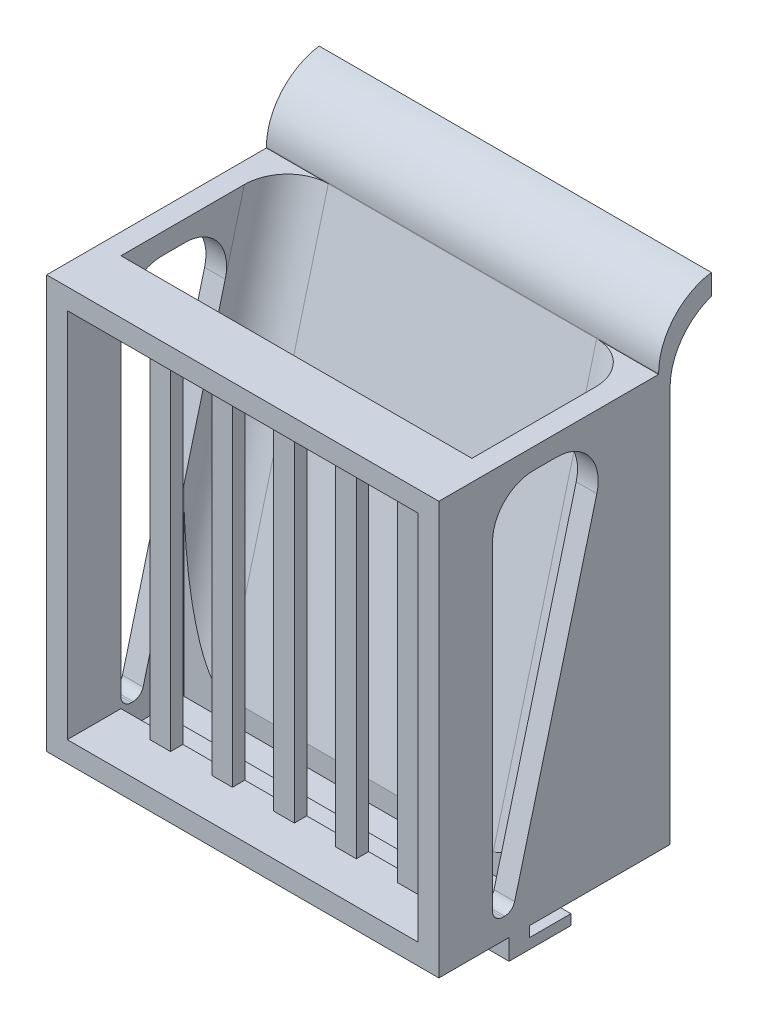
from build123d import *

# Parameters (mm, degrees)
SKETCH1_W                = 5
SKETCH1_H                = 90
SKETCH1_H_2              = 5
SKETCH1_W_2              = 10
BOSS_EXTRUDE1_DEPTH      = 3
SKETCH1_3_W              = 5
SKETCH1_3_H              = 5
SKETCH1_3_H_2            = 90
SKETCH1_3_W_2            = 10
BOSS_EXTRUDE2_DEPTH      = 13
SKETCH2_W                = 5
SKETCH2_H                = 5
BOSS_EXTRUDE3_DEPTH      = 33
BOSS_EXTRUDE4_DEPTH      = 10
BOSS_EXTRUDE4_DEPTH_BACK = 17.787183465
SKETCH3_W                = 95
SKETCH3_H                = 100
SKETCH7_W                = 85
SKETCH7_H                = 5
SKETCH7_W_2              = 5
BOSS_EXTRUDE6_DEPTH      = 5
SKETCH8_W                = 95
SKETCH8_H                = 2.5
BOSS_EXTRUDE7_DEPTH      = 10
CUT_EXTRUDE1_DEPTH       = 132.816960102
BOSS_EXTRUDE9_REACH      = 101.483
SKETCH9_W                = 5
SKETCH9_H                = 5
SKETCH11_W               = 5
SKETCH11_H               = 93.06639607
BOSS_EXTRUDE12_DEPTH     = 10
SKETCH13_W               = 5
SKETCH13_H               = 10
BOSS_EXTRUDE13_DEPTH     = 4
FILLET2_R                = 10
FILLET3_START            = -44.017467249
FILLET3_DEPTH            = 5
FILLET3_START_2          = 45.982532751
FILLET3_2_DEPTH          = 5
FILLET4_R                = 10
SKETCH14_W               = 95
SKETCH14_H               = 2.777998613
BOSS_EXTRUDE14_DEPTH     = 15
SKETCH15_W               = 95
SKETCH15_H               = 5
BOSS_EXTRUDE15_DEPTH     = 10
FILLET5_R                = 15


with BuildPart() as part:
    # Sketch1 → Boss-Extrude1 (new body)
    with BuildSketch(Plane.XY):
        with Locations((48.482532751, -25.633187773)):
            Rectangle(SKETCH1_W, SKETCH1_H)
        with Locations((48.482532751, 21.866812227)):
            Rectangle(SKETCH1_W, SKETCH1_H_2)
        with Locations((40.982532751, 21.866812227)):
            Rectangle(SKETCH1_W_2, SKETCH1_H_2)
        with Locations((33.482532751, 21.866812227)):
            Rectangle(SKETCH1_W, SKETCH1_H_2)
        with Locations((33.482532751, -25.633187773)):
            Rectangle(SKETCH1_W, SKETCH1_H)
        with Locations((18.482532751, -25.633187773)):
            Rectangle(SKETCH1_W, SKETCH1_H)
        with Locations((18.482532751, 21.866812227)):
            Rectangle(SKETCH1_W, SKETCH1_H_2)
        with Locations((25.982532751, 21.866812227)):
            Rectangle(SKETCH1_W_2, SKETCH1_H_2)
        with Locations((10.982532751, 21.866812227)):
            Rectangle(SKETCH1_W_2, SKETCH1_H_2)
        with Locations((3.482532751, 21.866812227)):
            Rectangle(SKETCH1_W, SKETCH1_H_2)
        with Locations((3.482532751, -25.633187773)):
            Rectangle(SKETCH1_W, SKETCH1_H)
        with Locations((-4.017467249, 21.866812227)):
            Rectangle(SKETCH1_W_2, SKETCH1_H_2)
        with Locations((-11.517467249, 21.866812227)):
            Rectangle(SKETCH1_W, SKETCH1_H_2)
        with Locations((-11.517467249, -25.633187773)):
            Rectangle(SKETCH1_W, SKETCH1_H)
        with Locations((-19.017467249, 21.866812227)):
            Rectangle(SKETCH1_W_2, SKETCH1_H_2)
        with Locations((-26.517467249, 21.866812227)):
            Rectangle(SKETCH1_W, SKETCH1_H_2)
        with Locations((-26.517467249, -25.633187773)):
            Rectangle(SKETCH1_W, SKETCH1_H)
        with Locations((-34.017467249, 21.866812227)):
            Rectangle(SKETCH1_W_2, SKETCH1_H_2)
        with Locations((-41.517467249, 21.866812227)):
            Rectangle(SKETCH1_W, SKETCH1_H_2)
        with Locations((-41.517467249, -25.633187773)):
            Rectangle(SKETCH1_W, SKETCH1_H)
        with Locations((48.482532751, -73.133187773)):
            Rectangle(SKETCH1_W, SKETCH1_H_2)
        with Locations((40.982532751, -73.133187773)):
            Rectangle(SKETCH1_W_2, SKETCH1_H_2)
        with Locations((33.482532751, -73.133187773)):
            Rectangle(SKETCH1_W, SKETCH1_H_2)
        with Locations((25.982532751, -73.133187773)):
            Rectangle(SKETCH1_W_2, SKETCH1_H_2)
        with Locations((18.482532751, -73.133187773)):
            Rectangle(SKETCH1_W, SKETCH1_H_2)
        with Locations((10.982532751, -73.133187773)):
            Rectangle(SKETCH1_W_2, SKETCH1_H_2)
        with Locations((3.482532751, -73.133187773)):
            Rectangle(SKETCH1_W, SKETCH1_H_2)
        with Locations((-4.017467249, -73.133187773)):
            Rectangle(SKETCH1_W_2, SKETCH1_H_2)
        with Locations((-11.517467249, -73.133187773)):
            Rectangle(SKETCH1_W, SKETCH1_H_2)
        with Locations((-19.017467249, -73.133187773)):
            Rectangle(SKETCH1_W_2, SKETCH1_H_2)
        with Locations((-26.517467249, -73.133187773)):
            Rectangle(SKETCH1_W, SKETCH1_H_2)
        with Locations((-34.017467249, -73.133187773)):
            Rectangle(SKETCH1_W_2, SKETCH1_H_2)
        with Locations((-41.517467249, -73.133187773)):
            Rectangle(SKETCH1_W, SKETCH1_H_2)
    extrude(amount=BOSS_EXTRUDE1_DEPTH)

    # Sketch1<3> → Boss-Extrude2 (add)
    with BuildSketch(Plane.XY):
        with Locations((48.482532751, 21.866812227)):
            Rectangle(SKETCH1_3_W, SKETCH1_3_H)
        with Locations((48.482532751, -25.633187773)):
            Rectangle(SKETCH1_3_W, SKETCH1_3_H_2)
        with Locations((48.482532751, -73.133187773)):
            Rectangle(SKETCH1_3_W, SKETCH1_3_H)
        with Locations((40.982532751, 21.866812227)):
            Rectangle(SKETCH1_3_W_2, SKETCH1_3_H)
        with Locations((33.482532751, 21.866812227)):
            Rectangle(SKETCH1_3_W, SKETCH1_3_H)
        with Locations((25.982532751, 21.866812227)):
            Rectangle(SKETCH1_3_W_2, SKETCH1_3_H)
        with Locations((18.482532751, 21.866812227)):
            Rectangle(SKETCH1_3_W, SKETCH1_3_H)
        with Locations((10.982532751, 21.866812227)):
            Rectangle(SKETCH1_3_W_2, SKETCH1_3_H)
        with Locations((3.482532751, 21.866812227)):
            Rectangle(SKETCH1_3_W, SKETCH1_3_H)
        with Locations((-4.017467249, 21.866812227)):
            Rectangle(SKETCH1_3_W_2, SKETCH1_3_H)
        with Locations((-11.517467249, 21.866812227)):
            Rectangle(SKETCH1_3_W, SKETCH1_3_H)
        with Locations((-19.017467249, 21.866812227)):
            Rectangle(SKETCH1_3_W_2, SKETCH1_3_H)
        with Locations((-26.517467249, 21.866812227)):
            Rectangle(SKETCH1_3_W, SKETCH1_3_H)
        with Locations((-34.017467249, 21.866812227)):
            Rectangle(SKETCH1_3_W_2, SKETCH1_3_H)
        with Locations((-41.517467249, 21.866812227)):
            Rectangle(SKETCH1_3_W, SKETCH1_3_H)
        with Locations((-41.517467249, -25.633187773)):
            Rectangle(SKETCH1_3_W, SKETCH1_3_H_2)
        with Locations((-41.517467249, -73.133187773)):
            Rectangle(SKETCH1_3_W, SKETCH1_3_H)
        with Locations((40.982532751, -73.133187773)):
            Rectangle(SKETCH1_3_W_2, SKETCH1_3_H)
        with Locations((33.482532751, -73.133187773)):
            Rectangle(SKETCH1_3_W, SKETCH1_3_H)
        with Locations((25.982532751, -73.133187773)):
            Rectangle(SKETCH1_3_W_2, SKETCH1_3_H)
        with Locations((18.482532751, -73.133187773)):
            Rectangle(SKETCH1_3_W, SKETCH1_3_H)
        with Locations((10.982532751, -73.133187773)):
            Rectangle(SKETCH1_3_W_2, SKETCH1_3_H)
        with Locations((3.482532751, -73.133187773)):
            Rectangle(SKETCH1_3_W, SKETCH1_3_H)
        with Locations((-4.017467249, -73.133187773)):
            Rectangle(SKETCH1_3_W_2, SKETCH1_3_H)
        with Locations((-11.517467249, -73.133187773)):
            Rectangle(SKETCH1_3_W, SKETCH1_3_H)
        with Locations((-19.017467249, -73.133187773)):
            Rectangle(SKETCH1_3_W_2, SKETCH1_3_H)
        with Locations((-26.517467249, -73.133187773)):
            Rectangle(SKETCH1_3_W, SKETCH1_3_H)
        with Locations((-34.017467249, -73.133187773)):
            Rectangle(SKETCH1_3_W_2, SKETCH1_3_H)
    extrude(amount=BOSS_EXTRUDE2_DEPTH)

    # Sketch2 → Boss-Extrude3 (add)
    with BuildSketch(Plane(origin=(0, 0, 0), x_dir=(-1, 0, 0), z_dir=(0, 0, -1))):
        with Locations((-48.482532751, 21.866812227)):
            Rectangle(SKETCH2_W, SKETCH2_H)
        with Locations((41.517467249, 21.866812227)):
            Rectangle(SKETCH2_W, SKETCH2_H)
        with Locations((41.517467249, -73.133187773)):
            Rectangle(SKETCH2_W, SKETCH2_H)
        with Locations((-48.482532751, -73.133187773)):
            Rectangle(SKETCH2_W, SKETCH2_H)
    extrude(amount=BOSS_EXTRUDE3_DEPTH)

    # Sketch3 → Boss-Extrude4 (add, two sides: drawn at the far end of the back side and taken through both)
    with BuildSketch(Plane(origin=(0, 0, -33), x_dir=(-1, 0, 0), z_dir=(0, 0, -1)).offset(-BOSS_EXTRUDE4_DEPTH_BACK)):
        with Locations((-3.482532751, -25.633187773)):
            Rectangle(SKETCH3_W, SKETCH3_H)
    extrude(amount=BOSS_EXTRUDE4_DEPTH + BOSS_EXTRUDE4_DEPTH_BACK)

    # Sketch7 → Boss-Extrude6 (add)
    with BuildSketch(Plane.XZ.offset(75.633187773)):
        with Locations((3.482532751, -6.5)):
            Rectangle(SKETCH7_W, SKETCH7_H)
        with Locations((48.482532751, -6.5)):
            Rectangle(SKETCH7_W_2, SKETCH7_H)
        with Locations((-41.517467249, -6.5)):
            Rectangle(SKETCH7_W_2, SKETCH7_H)
    extrude(amount=BOSS_EXTRUDE6_DEPTH)

    # Sketch8 → Boss-Extrude7 (add)
    with BuildSketch(Plane(origin=(0, 0, -9), x_dir=(-1, 0, 0), z_dir=(0, 0, -1))):
        with Locations((-3.482532751, -79.383187773)):
            Rectangle(SKETCH8_W, SKETCH8_H)
    extrude(amount=BOSS_EXTRUDE7_DEPTH)

    # Sketch5 → Cut-Extrude1 (cut, through all)
    with BuildSketch(Plane.ZY.offset(44.017467249)):
        Polygon((-15.212816535, -70.633187773), (-40.222001387, 24.366812227), (-15.212816535, 24.366812227), align=None)
    extrude(amount=-CUT_EXTRUDE1_DEPTH, mode=Mode.SUBTRACT)

    # Sketch9 → Boss-Extrude9 (add, up to next)
    with BuildSketch(Plane(origin=(0, 0, -15.212816535), x_dir=(-1, 0, 0), z_dir=(0, 0, -1)), mode=Mode.PRIVATE) as boss_extrude9_sk1:
        with Locations((41.517467249, 21.866812227)):
            Rectangle(SKETCH9_W, SKETCH9_H)
    boss_extrude9_tool1 = extrude(boss_extrude9_sk1.sketch, amount=BOSS_EXTRUDE9_REACH, mode=Mode.PRIVATE) - part.part
    # Sketch9 → Boss-Extrude9 (add, up to next)
    with BuildSketch(Plane(origin=(0, 0, -15.212816535), x_dir=(-1, 0, 0), z_dir=(0, 0, -1)), mode=Mode.PRIVATE) as boss_extrude9_sk2:
        with Locations((-48.482532751, 21.866812227)):
            Rectangle(SKETCH9_W, SKETCH9_H)
    boss_extrude9_tool2 = extrude(boss_extrude9_sk2.sketch, amount=BOSS_EXTRUDE9_REACH, mode=Mode.PRIVATE) - part.part
    add(boss_extrude9_tool1.solids().sort_by_distance((-41.517467, 21.866812, -15.212817))[0])
    add(boss_extrude9_tool2.solids().sort_by_distance((48.482533, 21.866812, -15.212817))[0])

    # Sketch11 → Boss-Extrude12 (add)
    with BuildSketch(Plane(origin=(0, -8.323116729, -31.616227955), x_dir=(1, 0, 0), z_dir=(0, 0.2545807398296556, 0.9670515223646491))):
        with Locations((-41.517467249, -17.899843642)):
            Rectangle(SKETCH11_W, SKETCH11_H)
        with Locations((48.482532751, -17.899843642)):
            Rectangle(SKETCH11_W, SKETCH11_H)
    extrude(amount=BOSS_EXTRUDE12_DEPTH)

    # Sketch13 → Boss-Extrude13 (add)
    with BuildSketch(Plane(origin=(0, -62.310071044, 16.40341142), x_dir=(1, 0, 0), z_dir=(0, -0.9670515223646491, 0.2545807398296557))):
        with Locations((48.482532751, -27.69342659)):
            Rectangle(SKETCH13_W, SKETCH13_H)
        with Locations((-41.517467249, -27.69342659)):
            Rectangle(SKETCH13_W, SKETCH13_H)
    extrude(amount=BOSS_EXTRUDE13_DEPTH)

    # Fillet2
    # the kernel refuses this fillet: 10 mm, written as the material it adds along each edge
    with BuildSketch(Plane(origin=(45.982532751, 19.366812227, 0), x_dir=(0, 0, -1), z_dir=(1, 0, 0)), Plane(origin=(-39.017467249, 19.366812227, 0), x_dir=(0, -1, 0), z_dir=(-1, 0, 0))) as fillet2_piece_1:
        with BuildLine():
            CenterArc((FILLET2_R, -FILLET2_R), FILLET2_R, 90, 90)
            Line((0, -FILLET2_R), (0, 0))
            Line((0, 0), (FILLET2_R, 0))
        make_face()
    extrude(amount=5)
    with BuildSketch(Plane(origin=(-39.017467249, 19.366812227, -28.565017825), x_dir=(0, -0.9670515223646489, 0.25458073982965584), z_dir=(-1, 0, 0))) as fillet2_piece_2:
        with BuildLine():
            CenterArc((FILLET2_R * 1.29732564482, FILLET2_R), FILLET2_R, 165.251256556, 104.748743444)
            Line((FILLET2_R * 0.330274122459, FILLET2_R * 1.25458073983), (0, 0))
            Line((0, 0), (FILLET2_R * 1.29732564482, 0))
        make_face()
    extrude(amount=5)
    with BuildSketch(Plane(origin=(50.982532751, 19.366812227, -28.565017825), x_dir=(0, 0, 1), z_dir=(-1, 0, 0))) as fillet2_piece_3:
        with BuildLine():
            CenterArc((FILLET2_R * 1.29732564482, -FILLET2_R), FILLET2_R, 90, 104.748743444)
            Line((FILLET2_R * 0.330274122459, -FILLET2_R * 1.25458073983), (0, 0))
            Line((0, 0), (FILLET2_R * 1.29732564482, 0))
        make_face()
    extrude(amount=5)

    # Fillet3: read off the stored shape, not the designer's step
    # Fillet3 outline → Fillet3 (add)
    with BuildSketch(Plane.YZ.offset(FILLET3_START)):
        with BuildLine():
            Line((-70.633187773, -4.872105861), (-68.769639622, -5.362693442))
            ThreePointArc((-68.769639622, -5.362693442), (-70.113229391, -4.471313367), (-70.633187773, -2.945064636))
            Line((-70.633187773, -2.945064636), (-70.633187773, -4.872105861))
        make_face()
        with BuildLine():
            Line((-70.633187773, 0), (-70.633187773, -2.5))
            ThreePointArc((-70.633187773, -2.5), (-69.900954726, -0.732233047), (-68.133187773, 0))
            Line((-68.133187773, 0), (-70.633187773, 0))
        make_face()
    extrude(amount=FILLET3_DEPTH)

    # Fillet3 2 outline → Fillet3 2 (add)
    with BuildSketch(Plane.YZ.offset(FILLET3_START_2)):
        with BuildLine():
            Line((-70.633187773, -4.872105861), (-68.769639622, -5.362693442))
            ThreePointArc((-68.769639622, -5.362693442), (-70.113229391, -4.471313367), (-70.633187773, -2.945064636))
            Line((-70.633187773, -2.945064636), (-70.633187773, -4.872105861))
        make_face()
        with BuildLine():
            Line((-70.633187773, 0), (-70.633187773, -2.5))
            ThreePointArc((-70.633187773, -2.5), (-69.900954726, -0.732233047), (-68.133187773, 0))
            Line((-68.133187773, 0), (-70.633187773, 0))
        make_face()
    extrude(amount=FILLET3_2_DEPTH)

    # Fillet4
    fillet4_edges = [part.edges().sort_by_distance(p)[0] for p in [
        (-39.017467249, -23.133187773, -27.717408961),
        (45.982532751, -23.133187773, -27.717408961),
    ]]
    fillet(fillet4_edges, radius=FILLET4_R - 0.0001)  # a hair under: the kernel refuses the full size

    # Sketch14 → Boss-Extrude14 (add)
    with BuildSketch(Plane(origin=(0, 24.366812227, 0), x_dir=(1, 0, 0), z_dir=(0, 1, 0))):
        with Locations((3.482532751, 41.611000694)):
            Rectangle(SKETCH14_W, SKETCH14_H)
    extrude(amount=BOSS_EXTRUDE14_DEPTH)

    # Sketch15 → Boss-Extrude15 (add)
    with BuildSketch(Plane(origin=(0, 0, -43), x_dir=(-1, 0, 0), z_dir=(0, 0, -1))):
        with Locations((-3.482532751, 36.866812227)):
            Rectangle(SKETCH15_W, SKETCH15_H)
    extrude(amount=BOSS_EXTRUDE15_DEPTH)

    # Fillet5
    # the kernel refuses this fillet: 15 mm, written as the material it adds along each edge
    with BuildSketch(Plane(origin=(-44.017467249, 34.366812227, -43), x_dir=(0, 0, -1), z_dir=(1, 0, 0))) as fillet5_piece_1:
        with BuildLine():
            CenterArc((15, -14.142135624), FILLET5_R, 109.471220634, 70.528779366)
            Line((0, -14.142135624), (-0.3, -14.142135624))
            Line((-0.3, -14.142135624), (-0.3, 0))
            Line((-0.3, 0), (0, 0.3))
            ThreePointArc((0, 0.3), (5, 0.3), (9.9, 0.282842712))
            Line((9.9, 0.282842712), (10, 0))
        make_face()
    extrude(amount=95)
    # the kernel refuses this fillet: 15 mm, written as the material it takes off along each edge
    with BuildSketch(Plane(origin=(88.06880968, 39.366812227, -40.222001387), x_dir=(0, -1, 0), z_dir=(-1, 0, 0))) as fillet5_2_piece_1:
        with BuildLine():
            CenterArc((14.834510772, -15), FILLET5_R, 90, 81.481228686)
            Line((0, -12.777998613), (-0.296690215, -12.733558585))
            ThreePointArc((-0.296690215, -12.733558585), (-0.3, -6.388999307), (-0.3, 0))
            Line((-0.3, 0), (0, 0.3))
            Line((0, 0.3), (14.834510772, 0.3))
            Line((14.834510772, 0.3), (14.834510772, 0))
        make_face()
    extrude(amount=169.172553859, mode=Mode.SUBTRACT)


solid = part.part
